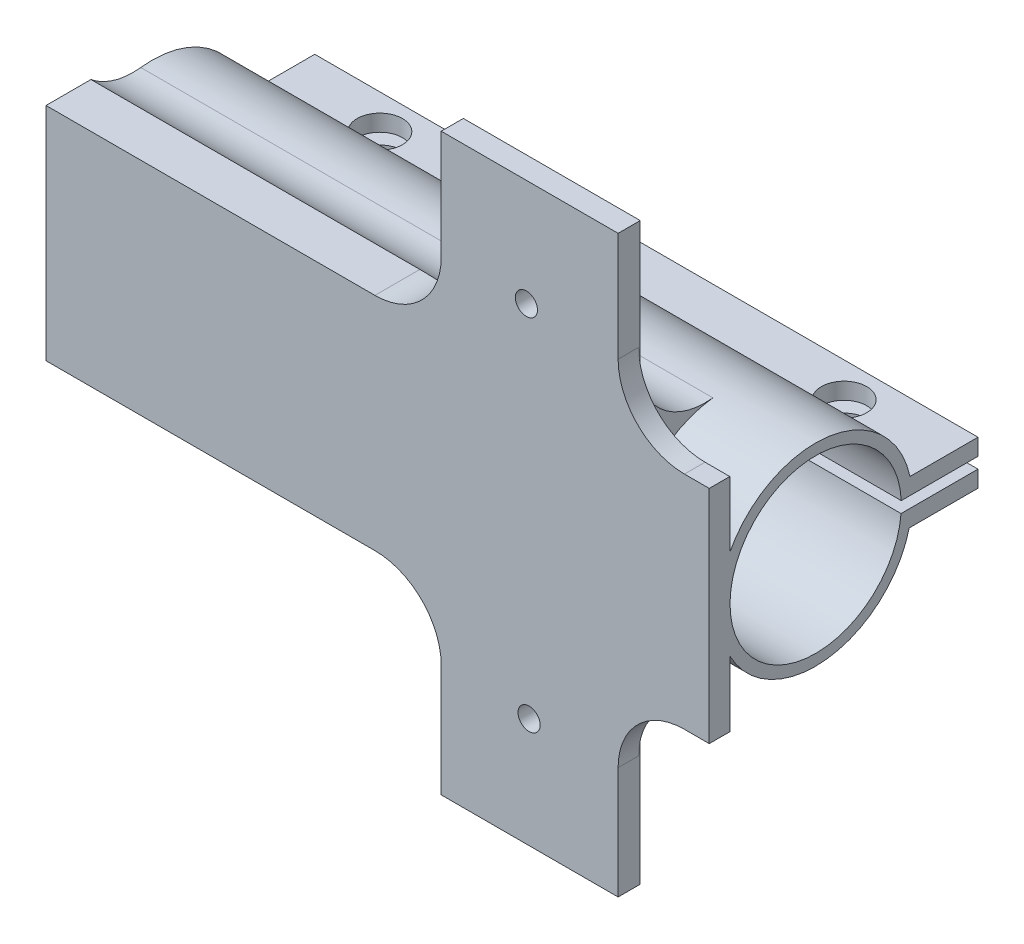
from build123d import *

# Parameters (mm, degrees)
SKETCH1_R                          = 4.375
SKETCH1_W                          = 0.93
SKETCH1_H                          = 10
BOSS_EXTRUDE1_DEPTH                = 30
SKETCH2_W                          = 8
SKETCH2_H                          = 26
BOSS_EXTRUDE3_DEPTH                = 1
FILLET4_R                          = 3
FILLET5_DEPTH                      = 25.878263471
FILLET5_START                      = 14.878263371
FILLET5_2_DEPTH                    = 11.0000001
FILLET5_START_2                    = -3
FILLET5_3_DEPTH                    = 2.07
CUT_EXTRUDE1_REACH                 = 37.895
SKETCH3_R                          = 0.5
SKETCH4_W                          = 10
SKETCH4_H                          = 2
BOSS_EXTRUDE4_DEPTH                = 30
CUT_EXTRUDE2_REACH                 = 39.004
SKETCH5_R                          = 3.875
CUT_EXTRUDE4_REACH                 = 39.004
M2_5X0_45_TAPPED_HOLE1_D           = 2.05
M2_5X0_45_TAPPED_HOLE1_CSINK_D     = 2.55
M2_5X0_45_TAPPED_HOLE1_CSINK_ANGLE = 90


with BuildPart() as part:
    # Sketch1 → Boss-Extrude1 (new body)
    with BuildSketch(Plane(origin=(0, 0, 0), x_dir=(0, 0, -1), z_dir=(1, 0, 0))):
        with Locations((4.805, 5)):
            Circle(SKETCH1_R)
        with Locations((0.465, 5)):
            Rectangle(SKETCH1_W, SKETCH1_H)
    extrude(amount=BOSS_EXTRUDE1_DEPTH)

    # Sketch2 → Boss-Extrude3 (add)
    with BuildSketch(Plane.XY):
        with Locations((21.878263471, 4.931133475)):
            Rectangle(SKETCH2_W, SKETCH2_H)
    extrude(amount=-BOSS_EXTRUDE3_DEPTH)

    # Fillet4
    fillet4_edges = [part.edges().sort_by_distance(p)[0] for p in [
        (17.878263471, 10, -0.465),
        (25.878263471, 10, -0.465),
        (17.878263471, 0, -0.465),
        (25.878263471, 0, -0.465),
    ]]
    fillet(fillet4_edges, radius=FILLET4_R)

    # Fillet5: read off the stored shape, not the designer's step
    # Fillet5 outline → Fillet5 (add)
    with BuildSketch(Plane.YZ):
        with BuildLine():
            ThreePointArc((9.344098712, -4.285932203), (9.442351653, -3.091914153), (10, -2.031555221))
            Line((10, -2.031555221), (10, -0.93))
            Line((10, -0.93), (7.031009601, -0.93))
            ThreePointArc((7.031009601, -0.93), (8.602231494, -2.32214816), (9.344098712, -4.285932203))
        make_face()
        with BuildLine():
            ThreePointArc((0, -2.031555221), (0.557648347, -3.091914153), (0.655901288, -4.285932203))
            ThreePointArc((0.655901288, -4.285932203), (1.397768506, -2.32214816), (2.968990399, -0.93))
            Line((2.968990399, -0.93), (0, -0.93))
            Line((0, -0.93), (0, -2.031555221))
        make_face()
    extrude(amount=FILLET5_DEPTH)

    # Fillet5 2 outline → Fillet5 2 (add)
    with BuildSketch(Plane.YZ.offset(FILLET5_START)):
        with BuildLine():
            ThreePointArc((10, -2.031555221), (11.037478267, -1.219341931), (12.322909258, -0.93))
            Line((12.322909258, -0.93), (10, -0.93))
            Line((10, -0.93), (10, -2.031555221))
        make_face()
        with BuildLine():
            Line((0, -2.031555221), (0, -0.93))
            Line((0, -0.93), (-2.322909258, -0.93))
            ThreePointArc((-2.322909258, -0.93), (-1.037478267, -1.219341931), (0, -2.031555221))
        make_face()
    extrude(amount=FILLET5_2_DEPTH)

    # Fillet5 3 outline → Fillet5 3 (cut)
    with BuildSketch(Plane.XY.offset(FILLET5_START_2)):
        with BuildLine():
            ThreePointArc((14.878263471, 10), (16.999583814, 10.878679656), (17.878263471, 13))
            Line((17.878263471, 13), (17.878263471, 14))
            Line((17.878263471, 14), (14.878263371, 14))
            Line((14.878263371, 14), (14.878263471, 10))
        make_face()
        with BuildLine():
            Line((14.878263371, -4), (17.878263471, -4))
            Line((17.878263471, -4), (17.878263471, -3))
            ThreePointArc((17.878263471, -3), (16.999583814, -0.878679657), (14.878263471, 0))
            Line((14.878263471, 0), (14.878263371, -4))
        make_face()
    extrude(amount=FILLET5_3_DEPTH, mode=Mode.SUBTRACT)

    # Sketch3 → Cut-Extrude1 (cut, up to next)
    with BuildSketch(Plane(origin=(0, 0, -1), x_dir=(-1, 0, 0), z_dir=(0, 0, -1)), mode=Mode.PRIVATE) as cut_extrude1_sk1:
        with Locations((-21.730165356, 13.098626711)):
            Circle(SKETCH3_R)
    cut_extrude1_tool1 = extrude(cut_extrude1_sk1.sketch, amount=-CUT_EXTRUDE1_REACH, mode=Mode.PRIVATE) & part.part
    # Sketch3 → Cut-Extrude1 (cut, up to next)
    with BuildSketch(Plane(origin=(0, 0, -1), x_dir=(-1, 0, 0), z_dir=(0, 0, -1)), mode=Mode.PRIVATE) as cut_extrude1_sk2:
        with Locations((-21.851713242, -3.100917298)):
            Circle(SKETCH3_R)
    cut_extrude1_tool2 = extrude(cut_extrude1_sk2.sketch, amount=-CUT_EXTRUDE1_REACH, mode=Mode.PRIVATE) & part.part
    add(cut_extrude1_tool1.solids().sort_by_distance((21.730165, 13.098627, -1))[0], mode=Mode.SUBTRACT)
    add(cut_extrude1_tool2.solids().sort_by_distance((21.851713, -3.100917, -1))[0], mode=Mode.SUBTRACT)

    # Sketch4 → Boss-Extrude4 (add)
    with BuildSketch(Plane(origin=(30, 0, 0), x_dir=(0, 0, -1), z_dir=(1, 0, 0))):
        with Locations((7.157056942, 4.926549366)):
            Rectangle(SKETCH4_W, SKETCH4_H)
    extrude(amount=-BOSS_EXTRUDE4_DEPTH)

    # Sketch5 → Cut-Extrude2 (cut, up to next)
    with BuildSketch(Plane(origin=(30, 0, 0), x_dir=(0, 0, -1), z_dir=(1, 0, 0)), mode=Mode.PRIVATE) as cut_extrude2_sk1:
        with Locations((4.815292967, 5.000024119)):
            Circle(SKETCH5_R)
    cut_extrude2_tool1 = extrude(cut_extrude2_sk1.sketch, amount=-CUT_EXTRUDE2_REACH, mode=Mode.PRIVATE) & part.part
    add(cut_extrude2_tool1.solids().sort_by_distance((30, 5.000024, -4.815293))[0], mode=Mode.SUBTRACT)

    # Sketch6 → Cut-Extrude4 (cut, up to next)
    with BuildSketch(Plane(origin=(30, 0, 0), x_dir=(0, 0, -1), z_dir=(1, 0, 0)), mode=Mode.PRIVATE) as cut_extrude4_sk1:
        with BuildLine():
            Line((12.157056942, 5.176549366), (12.157056942, 4.676549366))
            Line((12.157056942, 4.676549366), (8.676767955, 4.676549366))
            add(Edge.make_bspline(
                [(8.676767955, 4.676549366), (8.69766925, 4.926395918), (8.686270084, 5.176549366)],
                knots=[0, 0, 0, 1, 1, 1], degree=2))
            Line((8.686270084, 5.176549366), (12.157056942, 5.176549366))
        make_face()
    cut_extrude4_tool1 = extrude(cut_extrude4_sk1.sketch, amount=-CUT_EXTRUDE4_REACH, mode=Mode.PRIVATE) & part.part
    add(cut_extrude4_tool1.solids().sort_by_distance((30, 4.926435, -10.421978))[0], mode=Mode.SUBTRACT)

    # M2.5x0.45 Tapped Hole1 (through all)
    with Locations(Plane(origin=(0, 3.926549366, 0), x_dir=(-1, 0, 0), z_dir=(0, -1, 0))):
        with Locations((-25.5, 10.599323574), (-4.5, 10.599323574)):
            CounterSinkHole(M2_5X0_45_TAPPED_HOLE1_D / 2, M2_5X0_45_TAPPED_HOLE1_CSINK_D / 2, counter_sink_angle=M2_5X0_45_TAPPED_HOLE1_CSINK_ANGLE)


solid = part.part
